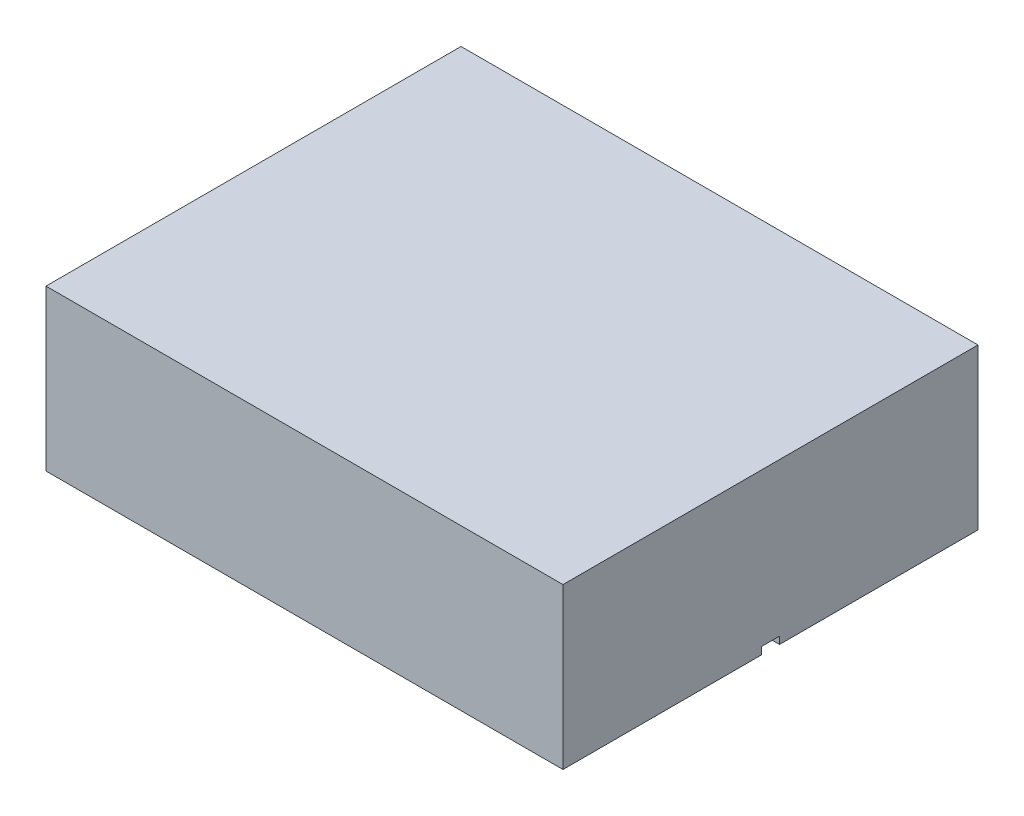
from build123d import *

# Parameters (mm, degrees)
SKETCH2_W           = 180.34
SKETCH2_H           = 144.78
BOSS_EXTRUDE1_DEPTH = 55.88
CUT_EXTRUDE2_DEPTH  = 2.54
SKETCH3_R           = 2.54
CUT_EXTRUDE1_DEPTH  = 2.54


with BuildPart() as part:
    # Sketch2 → Boss-Extrude1 (new body)
    with BuildSketch(Plane(origin=(0, 0, 0), x_dir=(1, 0, 0), z_dir=(0, 1, 0))):
        with Locations((90.17, 72.39)):
            Rectangle(SKETCH2_W, SKETCH2_H)
    extrude(amount=BOSS_EXTRUDE1_DEPTH)

    # Sketch4 → Cut-Extrude2 (cut)
    with BuildSketch(Plane.XZ):
        with BuildLine():
            Line((0, -69.215), (2.54, -69.215))
            ThreePointArc((2.54, -69.215), (5.715, -72.39), (2.54, -75.565))
            Line((2.54, -75.565), (0, -75.565))
            ThreePointArc((0, -75.565), (-3.175, -72.39), (0, -69.215))
        make_face()
        with BuildLine():
            Line((180.34, -69.215), (177.8, -69.215))
            ThreePointArc((177.8, -69.215), (174.625, -72.39), (177.8, -75.565))
            Line((177.8, -75.565), (180.34, -75.565))
            ThreePointArc((180.34, -75.565), (183.515, -72.39), (180.34, -69.215))
        make_face()
    extrude(amount=-CUT_EXTRUDE2_DEPTH, mode=Mode.SUBTRACT)

    # Sketch3 → Cut-Extrude1 (cut)
    with BuildSketch(Plane.XZ):
        with Locations((13.382501665, -72.39)):
            Circle(SKETCH3_R)
        with Locations((166.957498335, -72.39)):
            Circle(SKETCH3_R)
    extrude(amount=-CUT_EXTRUDE1_DEPTH, mode=Mode.SUBTRACT)


solid = part.part
